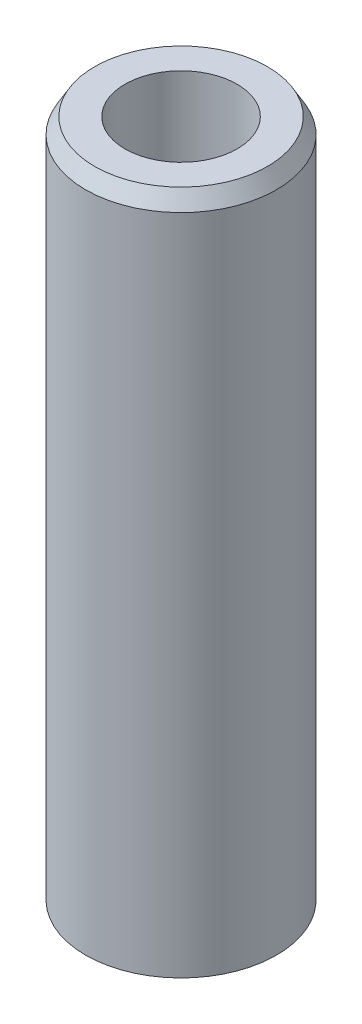
from build123d import *
from OCP.BRepFilletAPI import BRepFilletAPI_MakeChamfer

# Parameters (mm, degrees)
SKETCH1_R           = 20
BOSS_EXTRUDE1_DEPTH = 144.007816755
SKETCH2_R           = 11.746112905
CUT_EXTRUDE1_DEPTH  = 147.759160827
CHAMFER1_SIZE       = 3.28476298
CHAMFER1_SIZE2      = 1.896458791


with BuildPart() as part:
    # Sketch1 → Boss-Extrude1 (new body)
    with BuildSketch(Plane(origin=(0, 0, 0), x_dir=(1, 0, 0), z_dir=(0, 1, 0))):
        Circle(SKETCH1_R)
    extrude(amount=BOSS_EXTRUDE1_DEPTH)

    # Sketch2 → Cut-Extrude1 (cut, through all)
    with BuildSketch(Plane(origin=(0, 0, 0), x_dir=(1, 0, 0), z_dir=(0, 1, 0))):
        Circle(SKETCH2_R)
    extrude(amount=CUT_EXTRUDE1_DEPTH, mode=Mode.SUBTRACT)

    # Chamfer1: one chamfer whose edges measure the first distance from different faces: ONE call of the kernel's chamfer builder (chamfer() names one face for all edges)
    chamfer1_edges_1 = [part.edges().sort_by_distance(p)[0] for p in [
        (-20, 144.007816755, 0),
    ]]
    chamfer1_side_1 = [part.faces().sort_by_distance(p)[0] for p in [
        (-20, 72.003908378, 0),
    ]]
    chamfer1_edges_2 = [part.edges().sort_by_distance(p)[0] for p in [
        (-20, 0, 0),
    ]]
    chamfer1_side_2 = [part.faces().sort_by_distance(p)[0] for p in [
        (-19.434314575, 0, 0),
    ]]
    chamfer1 = BRepFilletAPI_MakeChamfer(part.part.solid().wrapped)
    for e in chamfer1_edges_1:
        chamfer1.Add(CHAMFER1_SIZE, CHAMFER1_SIZE2, e.wrapped, chamfer1_side_1[0].wrapped)  # the first distance lies on this face
    for e in chamfer1_edges_2:
        chamfer1.Add(CHAMFER1_SIZE, CHAMFER1_SIZE2, e.wrapped, chamfer1_side_2[0].wrapped)  # the first distance lies on this face
    add(Compound.cast(chamfer1.Shape()), mode=Mode.REPLACE)


solid = part.part
